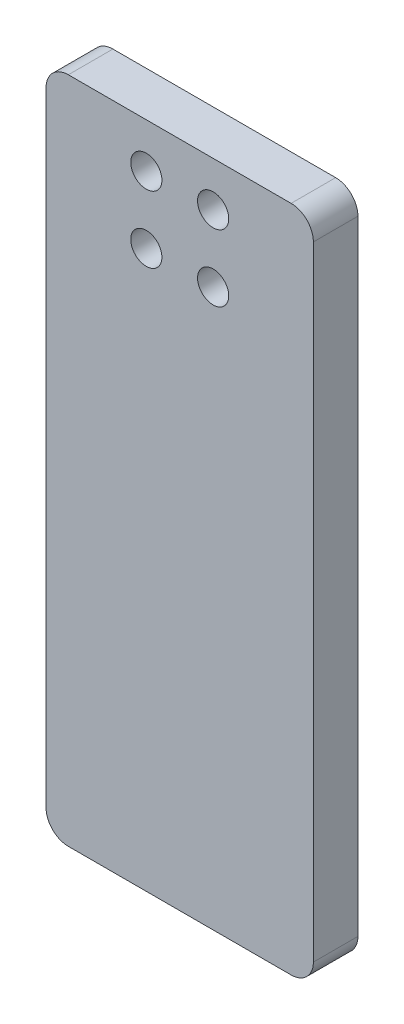
from build123d import *

# Parameters (mm, degrees)
IZIM1_W               = 60
IZIM1_H               = 150
TABAN_FLAN_1_DEPTH    = 10
IZIM6_R               = 3.5
KES_EKSTR_ZYON1_DEPTH = 26
RADYUS1_R             = 5


# Sheet-metal steps are written as plain solids
with BuildPart() as part:
    # Çizim1 → Taban-Flanş1 (new body)
    with BuildSketch(Plane.XY):
        Rectangle(IZIM1_W, IZIM1_H)
    extrude(amount=-TABAN_FLAN_1_DEPTH)

    # Çizim6 → Kes-Ekstrüzyon1 (cut)
    with BuildSketch(Plane.XY):
        with Locations((7.5, 65)):
            Circle(IZIM6_R)
        with Locations((-7.5, 65)):
            Circle(IZIM6_R)
        with Locations((7.5, 50)):
            Circle(IZIM6_R)
        with Locations((-7.5, 50)):
            Circle(IZIM6_R)
    extrude(amount=-KES_EKSTR_ZYON1_DEPTH, mode=Mode.SUBTRACT)

    # Radyus1
    radyus1_edges = [part.edges().sort_by_distance(p)[0] for p in [
        (30, -75, -5),
        (-30, -75, -5),
        (-30, 75, -5),
        (30, 75, -5),
    ]]
    fillet(radyus1_edges, radius=RADYUS1_R)


solid = part.part
